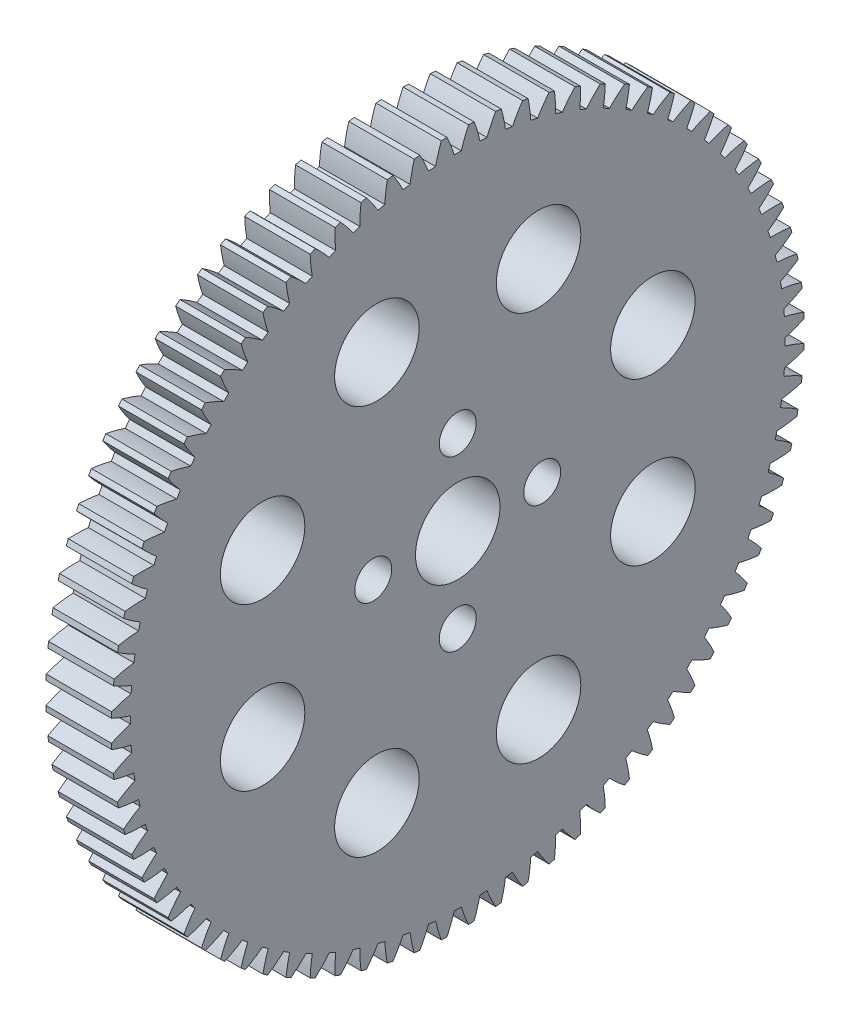
from build123d import *

# Parameters (mm, degrees)
BASPROSKE_W        = 6.2
BASPROSKE_H        = 32.8
TOOTHCUT_DEPTH     = 47.798717931
TEETHCUTS_COUNT    = 80
TEETHCUTS_ANGLE    = 355.5
BORSKE_R           = 4
BORE_DEPTH         = 50.0000508
SKETCH1_R          = 4
SKETCH1_R_2        = 1.75
CUT_EXTRUDE1_DEPTH = 47.776337838


with BuildPart() as part:
    # BasProSke → Base-Revolve (revolve)
    with BuildSketch(Plane(origin=(0, 0, 0), x_dir=(1, 0, 0), z_dir=(0, 1, 0))):
        with Locations((3.1, 16.4)):
            Rectangle(BASPROSKE_W, BASPROSKE_H)
    revolve(axis=Axis((-10, 0, 0), (1, 0, 0)))

    # TooCutSke → ToothCut (cut, through all)
    with BuildSketch(Plane(origin=(0, 0, 0), x_dir=(0, 0, -1), z_dir=(1, 0, 0))):
        with BuildLine():
            ThreePointArc((0.335706178, 30.997182168), (0, 30.999), (-0.335706178, 30.997182168))
            ThreePointArc((-0.335706178, 30.997182168), (-0.651023397, 31.916413715), (-1.035171918, 32.809073505))
            ThreePointArc((-1.035171918, 32.809073505), (0, 32.8254), (1.035171918, 32.809073505))
            ThreePointArc((1.035171918, 32.809073505), (0.651023397, 31.916413715), (0.335706178, 30.997182168))
        make_face()
    toothcut = extrude(amount=TOOTHCUT_DEPTH, mode=Mode.SUBTRACT)

    # TeethCuts: ToothCut ×80 about axis
    teethcuts_axis = Axis((-10, 0, 0), (1, 0, 0))
    for i in range(1, TEETHCUTS_COUNT):
        add(toothcut.rotate(teethcuts_axis, i * TEETHCUTS_ANGLE / (TEETHCUTS_COUNT - 1)), mode=Mode.SUBTRACT)

    # BorSke → Bore (cut, symmetric)
    with BuildSketch(Plane(origin=(0, 0, 0), x_dir=(0, 0, -1), z_dir=(1, 0, 0))):
        Circle(BORSKE_R)
    extrude(amount=BORE_DEPTH, both=True, mode=Mode.SUBTRACT)

    # Sketch1 → Cut-Extrude1 (cut, through all)
    with BuildSketch(Plane(origin=(6.2, 0, 0), x_dir=(0, 0, -1), z_dir=(1, 0, 0))):
        with Locations((-7.653668647, 18.47759065)):
            Circle(SKETCH1_R)
        with Locations((7.653668647, -18.47759065)):
            Circle(SKETCH1_R)
        with Locations((18.47759065, 7.653668647)):
            Circle(SKETCH1_R)
        with Locations((-18.47759065, -7.653668647)):
            Circle(SKETCH1_R)
        with Locations((7.653668647, 18.47759065)):
            Circle(SKETCH1_R)
        with Locations((18.47759065, -7.653668647)):
            Circle(SKETCH1_R)
        with Locations((-7.653668647, -18.47759065)):
            Circle(SKETCH1_R)
        with Locations((-18.47759065, 7.653668647)):
            Circle(SKETCH1_R)
        with Locations((0, 8)):
            Circle(SKETCH1_R_2)
        with Locations((0, -8)):
            Circle(SKETCH1_R_2)
        with Locations((8, 0)):
            Circle(SKETCH1_R_2)
        with Locations((-8, 0)):
            Circle(SKETCH1_R_2)
    extrude(amount=-CUT_EXTRUDE1_DEPTH, mode=Mode.SUBTRACT)


solid = part.part
